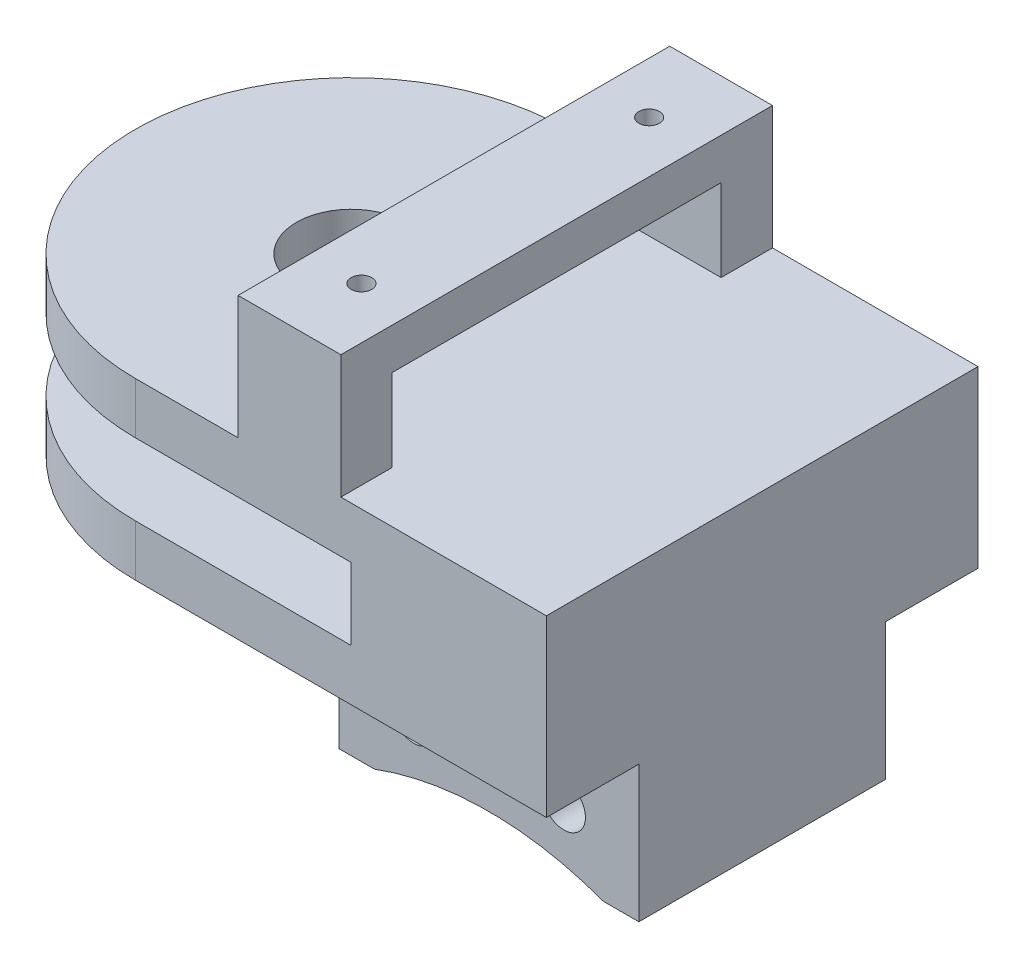
from build123d import *

# Parameters (mm, degrees)
SKETCH1_R           = 3.3782
BOSS_EXTRUDE1_DEPTH = 3.175
BOSS_EXTRUDE2_DEPTH = 4.445
SKETCH7_W           = 18.542
SKETCH7_H           = 15.24
BOSS_EXTRUDE4_DEPTH = 8.43915
SKETCH8_R           = 1.3335
CUT_EXTRUDE3_DEPTH  = 37.635615509
SKETCH9_R           = 20.32
CUT_EXTRUDE4_DEPTH  = 37.635615509
SKETCH11_W          = 6.35
SKETCH11_H          = 3.175
BOSS_EXTRUDE8_DEPTH = 5.08
SKETCH14_W          = 6.35
SKETCH14_H          = 26.67
SKETCH14_R          = 0.635
BOSS_EXTRUDE9_DEPTH = 2.54


with BuildPart() as part:
    # Sketch1 → Boss-Extrude1 (new body)
    with BuildSketch(Plane(origin=(0, 0, 0), x_dir=(1, 0, 0), z_dir=(0, 1, 0))):
        with BuildLine():
            ThreePointArc((0, 13.335), (-13.335, 0), (0, -13.335))
            Line((0, -13.335), (25.4, -13.335))
            Line((25.4, -13.335), (25.4, 13.335))
            Line((25.4, 13.335), (0, 13.335))
        make_face()
        Circle(SKETCH1_R, mode=Mode.SUBTRACT)
    boss_extrude1 = extrude(amount=BOSS_EXTRUDE1_DEPTH)

    # Sketch2 → Boss-Extrude2 (add)
    with BuildSketch(Plane(origin=(0, 0, 0), x_dir=(-1, 0, 0), z_dir=(0, -1, 0))):
        Polygon((-25.4, 13.335), (-25.4, -13.335), (-13.335, -13.335), (-13.335, 0), (-13.335, 13.335), align=None)
    extrude(amount=BOSS_EXTRUDE2_DEPTH)

    # Mirror2: Boss-Extrude1 across plane
    add(boss_extrude1.mirror(Plane(origin=(0, -2.2225, 0), x_dir=(0, 0, 1), z_dir=(0, -1, 0))))

    # Sketch7 → Boss-Extrude4 (add)
    with BuildSketch(Plane(origin=(0, -7.62, 0), x_dir=(-1, 0, 0), z_dir=(0, -1, 0))):
        with Locations((-16.129, 0)):
            Rectangle(SKETCH7_W, SKETCH7_H)
    extrude(amount=BOSS_EXTRUDE4_DEPTH)

    # Sketch8 → Cut-Extrude3 (cut, through all)
    with BuildSketch(Plane(origin=(0, 0, -7.62), x_dir=(-1, 0, 0), z_dir=(0, 0, -1))):
        with Locations((-20.7645, -12.1285)):
            Circle(SKETCH8_R)
        with Locations((-11.4935, -12.1285)):
            Circle(SKETCH8_R)
    extrude(amount=-CUT_EXTRUDE3_DEPTH, mode=Mode.SUBTRACT)

    # Sketch9 → Cut-Extrude4 (cut, through all)
    with BuildSketch(Plane(origin=(0, 0, -7.62), x_dir=(-1, 0, 0), z_dir=(0, 0, -1))):
        with Locations((-16.129, -35.10915)):
            Circle(SKETCH9_R)
    extrude(amount=-CUT_EXTRUDE4_DEPTH, mode=Mode.SUBTRACT)

    # Sketch11 → Boss-Extrude8 (add)
    with BuildSketch(Plane(origin=(0, 3.175, 0), x_dir=(1, 0, 0), z_dir=(0, 1, 0))):
        with Locations((9.525, 11.7475)):
            Rectangle(SKETCH11_W, SKETCH11_H)
        with Locations((9.525, -11.7475)):
            Rectangle(SKETCH11_W, SKETCH11_H)
    extrude(amount=BOSS_EXTRUDE8_DEPTH)

    # Sketch14 → Boss-Extrude9 (add)
    with BuildSketch(Plane(origin=(0, 8.255, 0), x_dir=(1, 0, 0), z_dir=(0, 1, 0))):
        with Locations((9.525, 0)):
            Rectangle(SKETCH14_W, SKETCH14_H)
        with Locations((9.525, 8.89)):
            Circle(SKETCH14_R, mode=Mode.SUBTRACT)
        with Locations((9.525, -8.89)):
            Circle(SKETCH14_R, mode=Mode.SUBTRACT)
    extrude(amount=BOSS_EXTRUDE9_DEPTH)


solid = part.part
